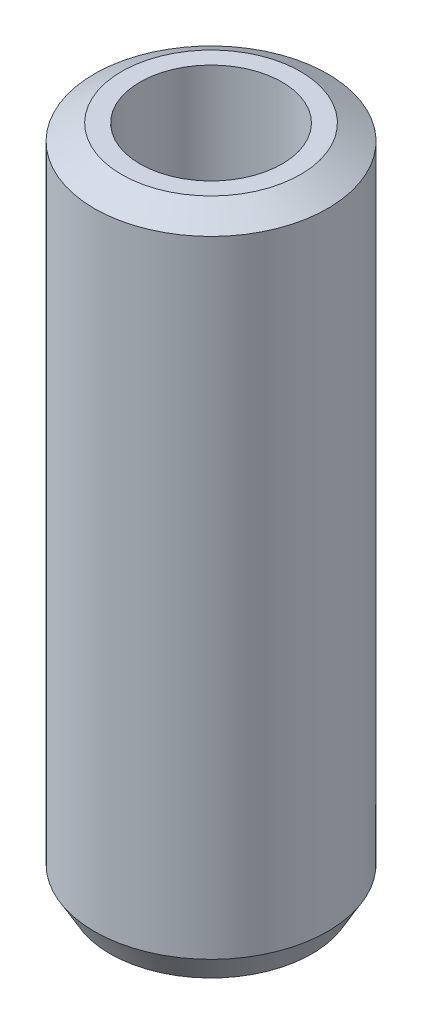
from build123d import *
from OCP.BRepFilletAPI import BRepFilletAPI_MakeChamfer

# Parameters (mm, degrees)
SKETCH1_R           = 17.5
BOSS_EXTRUDE1_DEPTH = 100.360531213
SKETCH2_R           = 10.652993547
CUT_EXTRUDE1_DEPTH  = 104.366997757
CHAMFER1_SIZE       = 2.362528627
CHAMFER1_SIZE2      = 4.092019617


with BuildPart() as part:
    # Sketch1 → Boss-Extrude1 (new body)
    with BuildSketch(Plane(origin=(0, 0, 0), x_dir=(1, 0, 0), z_dir=(0, 1, 0))):
        Circle(SKETCH1_R)
    extrude(amount=BOSS_EXTRUDE1_DEPTH)

    # Sketch2 → Cut-Extrude1 (cut, through all)
    with BuildSketch(Plane(origin=(0, 0, 0), x_dir=(1, 0, 0), z_dir=(0, 1, 0))):
        Circle(SKETCH2_R)
    extrude(amount=CUT_EXTRUDE1_DEPTH, mode=Mode.SUBTRACT)

    # Chamfer1: one chamfer whose edges measure the first distance from different faces: ONE call of the kernel's chamfer builder (chamfer() names one face for all edges)
    chamfer1_edges_1 = [part.edges().sort_by_distance(p)[0] for p in [
        (-17.5, 100.360531213, 0),
    ]]
    chamfer1_side_1 = [part.faces().sort_by_distance(p)[0] for p in [
        (-17.5, 50.180265607, 0),
    ]]
    chamfer1_edges_2 = [part.edges().sort_by_distance(p)[0] for p in [
        (-17.5, 0, 0),
    ]]
    chamfer1_side_2 = [part.faces().sort_by_distance(p)[0] for p in [
        (-17.005025253, 0, 0),
    ]]
    chamfer1 = BRepFilletAPI_MakeChamfer(part.part.solid().wrapped)
    for e in chamfer1_edges_1:
        chamfer1.Add(CHAMFER1_SIZE, CHAMFER1_SIZE2, e.wrapped, chamfer1_side_1[0].wrapped)  # the first distance lies on this face
    for e in chamfer1_edges_2:
        chamfer1.Add(CHAMFER1_SIZE, CHAMFER1_SIZE2, e.wrapped, chamfer1_side_2[0].wrapped)  # the first distance lies on this face
    add(Compound.cast(chamfer1.Shape()), mode=Mode.REPLACE)


solid = part.part
